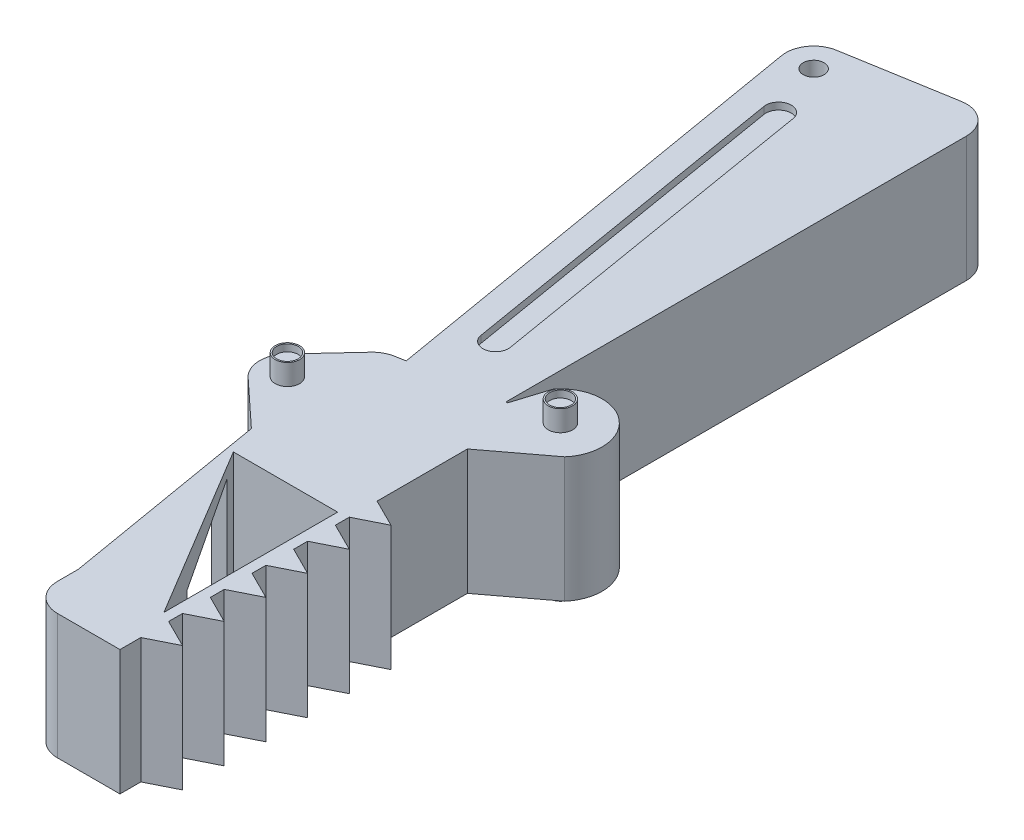
from build123d import *

# Parameters (mm, degrees)
BOSS_EXTRUDE2_DEPTH   = 9
FILLET3_R             = 4
FILLET4_R             = 4
FILLET5_R             = 4
BOSS_EXTRUDE3_DEPTH   = 18
LPATTERN1_COUNT       = 6
LPATTERN1_PITCH       = 6
MIRROR1_START         = -8.124245185
MIRROR1_OUTLINE_R     = 1.5
MIRROR1_DEPTH         = 12.777246129
MIRROR1_START_2       = -9
MIRROR1_2_OUTLINE_R   = 1.5
MIRROR1_2_DEPTH       = 18
MIRROR1_3_DEPTH       = 1
MIRROR1_START_3       = 8
MIRROR1_4_DEPTH       = 1
MIRROR1_START_4       = -11
MIRROR1_5_OUTLINE_R   = 1.75
MIRROR1_5_DEPTH       = 22
MIRROR1_START_5       = -12
MIRROR1_6_OUTLINE_R   = 1.75
MIRROR1_6_OUTLINE_R_2 = 1.55
MIRROR1_6_DEPTH       = 24
MIRROR1_START_6       = -136.757331166
MIRROR1_7_DEPTH       = 7.999999999


with BuildPart() as part:
    # Sketch2 → Boss-Extrude2 (new, symmetric)
    with BuildSketch(Plane(origin=(0, 0, 0), x_dir=(1, 0, 0), z_dir=(0, 1, 0))):
        Polygon((-131.994556455, -4.071203001), (-120.287458623, -73.085287508), (-107.994556455, -71), (-107.994556455, 0), align=None)
        with BuildLine():
            ThreePointArc((-106.180430892, -65.996333846), (-97.650502603, -65.078471315), (-96.922675808, -73.626711859))
            Line((-96.922675808, -73.626711859), (-104.905552704, -79.64947505))
            Line((-104.905552704, -79.64947505), (-104.905552704, -129.64947505))
            Line((-104.905552704, -129.64947505), (-117.905552704, -129.64947505))
            Line((-117.905552704, -129.64947505), (-117.905552704, -122.64947505))
            Line((-117.905552704, -122.64947505), (-122.994556455, -92.64947505))
            Line((-122.994556455, -92.64947505), (-132.520871847, -83.803610759))
            Line((-132.520871847, -83.803610759), (-122.994556455, -73.544501876))
            Line((-122.994556455, -73.544501876), (-107.994556455, -71))
            Line((-107.994556455, -71), (-107.755356075, -71))
            Line((-107.755356075, -71), (-106.180430892, -65.996333846))
        make_face()
    extrude(amount=BOSS_EXTRUDE2_DEPTH, both=True)

    # Fillet3
    fillet3_edges = [part.edges().sort_by_distance(p)[0] for p in [
        (-131.994556455, 0, 4.071203001),
        (-107.994556455, 0, 0),
    ]]
    fillet(fillet3_edges, radius=FILLET3_R)

    # Fillet4
    fillet4_edges = [part.edges().sort_by_distance(p)[0] for p in [
        (-132.520871847, 0, 83.803610759),
        (-122.994556455, 0, 73.544501876),
    ]]
    fillet(fillet4_edges, radius=FILLET4_R)

    # Fillet5
    fillet5_edges = [part.edges().sort_by_distance(p)[0] for p in [
        (-117.905552704, 0, 129.64947505),
    ]]
    fillet(fillet5_edges, radius=FILLET5_R)

    # Sketch4 → Boss-Extrude3 (add)
    with BuildSketch(Plane(origin=(0, 9, 0), x_dir=(1, 0, 0), z_dir=(0, 1, 0))):
        Polygon((-104.905552704, -126.64947505), (-104.905552704, -122.64947505), (-100.905552704, -124.64947505), align=None)
    boss_extrude3 = extrude(amount=-BOSS_EXTRUDE3_DEPTH)

    # LPattern1: Boss-Extrude3 ×6
    with Locations(*[(0, 0, -i * LPATTERN1_PITCH) for i in range(1, LPATTERN1_COUNT)]):
        add(boss_extrude3)

    # Mirror1: read off the stored shape, not the designer's step
    # Mirror1 outline → Mirror1 (cut)
    with BuildSketch(Plane(origin=(0, 0, 0), x_dir=(1, 0, 0), z_dir=(0, 1, 0)).offset(MIRROR1_START)):
        Polygon((-106.375961974, -96.859639276), (-121.375961974, -96.859639276), (-119.951756879, -99.233314435), (-121.823846672, -99.550883501), (-118.741773978, -117.719897586), (-110.854450034, -116.381943548), (-111.324238264, -113.612512127), (-106.375961974, -121.859639276), align=None)
        with Locations((-127.381917465, -7.345887954)):
            Circle(MIRROR1_OUTLINE_R)
    extrude(amount=MIRROR1_DEPTH, mode=Mode.SUBTRACT)

    # Mirror1 2 outline → Mirror1 2 (cut)
    with BuildSketch(Plane(origin=(0, 0, 0), x_dir=(1, 0, 0), z_dir=(0, 1, 0)).offset(MIRROR1_START_2)):
        Polygon((-106.375961974, -96.859639276), (-121.375961974, -96.859639276), (-106.375961974, -121.859639276), align=None)
        with Locations((-127.381917465, -7.345887954)):
            Circle(MIRROR1_2_OUTLINE_R)
    extrude(amount=MIRROR1_2_DEPTH, mode=Mode.SUBTRACT)

    # Mirror1 3 outline → Mirror1 3 (cut)
    with BuildSketch(Plane(origin=(0, 0, 0), x_dir=(1, 0, 0), z_dir=(0, 1, 0)).offset(MIRROR1_START_2)):
        with BuildLine():
            Line((-114.481804476, -63.909695389), (-122.650561904, -15.020919875))
            ThreePointArc((-122.650561904, -15.020919875), (-124.758454252, -13.516588893), (-126.262785233, -15.624481241))
            Line((-126.262785233, -15.624481241), (-118.094027806, -64.513256756))
            ThreePointArc((-118.094027806, -64.513256756), (-115.986135457, -66.017587738), (-114.481804476, -63.909695389))
        make_face()
    extrude(amount=MIRROR1_3_DEPTH, mode=Mode.SUBTRACT)

    # Mirror1 4 outline → Mirror1 4 (cut)
    with BuildSketch(Plane(origin=(0, 0, 0), x_dir=(1, 0, 0), z_dir=(0, 1, 0)).offset(MIRROR1_START_3)):
        with BuildLine():
            Line((-114.481804476, -63.909695389), (-122.650561904, -15.020919875))
            ThreePointArc((-122.650561904, -15.020919875), (-124.758454252, -13.516588893), (-126.262785233, -15.624481241))
            Line((-126.262785233, -15.624481241), (-118.094027806, -64.513256756))
            ThreePointArc((-118.094027806, -64.513256756), (-115.986135457, -66.017587738), (-114.481804476, -63.909695389))
        make_face()
    extrude(amount=MIRROR1_4_DEPTH, mode=Mode.SUBTRACT)

    # Mirror1 5 outline → Mirror1 5 (add)
    with BuildSketch(Plane(origin=(0, 0, 0), x_dir=(1, 0, 0), z_dir=(0, 1, 0)).offset(MIRROR1_START_4)):
        with Locations((-126.867893483, -83.59424119)):
            Circle(MIRROR1_5_OUTLINE_R)
        with Locations((-101.466636513, -69.708495286)):
            Circle(MIRROR1_5_OUTLINE_R)
    extrude(amount=MIRROR1_5_DEPTH)

    # Mirror1 6 outline → Mirror1 6 (add)
    # profile 1 of 2: a face of its own
    with BuildSketch(Plane(origin=(0, 0, 0), x_dir=(1, 0, 0), z_dir=(0, 1, 0)).offset(MIRROR1_START_5)):
        with Locations((-126.867893483, -83.59424119)):
            Circle(MIRROR1_6_OUTLINE_R)
        with Locations((-126.867893483, -83.59424119)):
            Circle(MIRROR1_6_OUTLINE_R_2, mode=Mode.SUBTRACT)
    # profile 2 of 2: a face of its own
    with BuildSketch(Plane(origin=(0, 0, 0), x_dir=(1, 0, 0), z_dir=(0, 1, 0)).offset(MIRROR1_START_5)):
        with Locations((-101.466636513, -69.708495286)):
            Circle(MIRROR1_6_OUTLINE_R)
        with Locations((-101.466636513, -69.708495286)):
            Circle(MIRROR1_6_OUTLINE_R_2, mode=Mode.SUBTRACT)
    extrude(amount=MIRROR1_6_DEPTH)

    # Mirror1 7 outline → Mirror1 7 (cut)
    with BuildSketch(Plane(origin=(0, 0, 0), x_dir=(0, 1, 0), z_dir=(0.9859154929577465, 0, -0.1672442547470129)).offset(MIRROR1_START_6)):
        Polygon((4.653000944, 77.774419934), (7.4664805, 77.774419934), (4.653000944, 96.202991363), align=None)
        Polygon((-8.124245185, 77.774419934), (-8.124245185, 96.202991363), (-8.855207199, 96.202991363), align=None)
    extrude(amount=MIRROR1_7_DEPTH, mode=Mode.SUBTRACT)


solid = part.part
